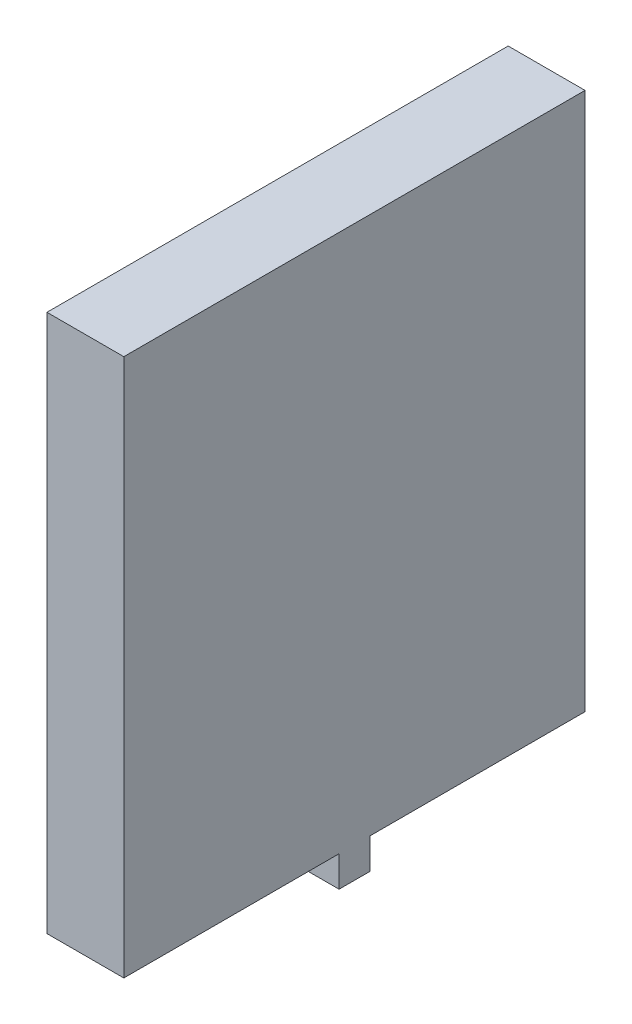
from build123d import *

# Parameters (mm, degrees)
CROQUIS1_W              = 60
CROQUIS1_H              = 70
SALIENTE_EXTRUIR1_DEPTH = 10
CROQUIS2_W              = 15
CROQUIS2_H              = 10
SALIENTE_EXTRUIR2_DEPTH = 20
CROQUIS3_R              = 3.5
CORTAR_EXTRUIR1_DEPTH   = 30
CROQUIS4_W              = 10
CROQUIS4_H              = 4
SALIENTE_EXTRUIR3_DEPTH = 4


with BuildPart() as part:
    # Croquis1 → Saliente-Extruir1 (new body)
    with BuildSketch(Plane(origin=(0, 0, 0), x_dir=(0, 0, -1), z_dir=(1, 0, 0))):
        Rectangle(CROQUIS1_W, CROQUIS1_H)
    extrude(amount=SALIENTE_EXTRUIR1_DEPTH)

    # Croquis2 → Saliente-Extruir2 (add)
    with BuildSketch(Plane.ZY):
        with Locations((0, -30)):
            Rectangle(CROQUIS2_W, CROQUIS2_H)
    extrude(amount=SALIENTE_EXTRUIR2_DEPTH)

    # Croquis3 → Cortar-Extruir1 (cut)
    with BuildSketch(Plane(origin=(0, -25, 0), x_dir=(1, 0, 0), z_dir=(0, 1, 0))):
        with Locations((-14, 0)):
            Circle(CROQUIS3_R)
    extrude(amount=-CORTAR_EXTRUIR1_DEPTH, mode=Mode.SUBTRACT)

    # Croquis4 → Saliente-Extruir3 (add)
    with BuildSketch(Plane.XZ.offset(35)):
        with Locations((5, 0)):
            Rectangle(CROQUIS4_W, CROQUIS4_H)
    extrude(amount=SALIENTE_EXTRUIR3_DEPTH)


solid = part.part
